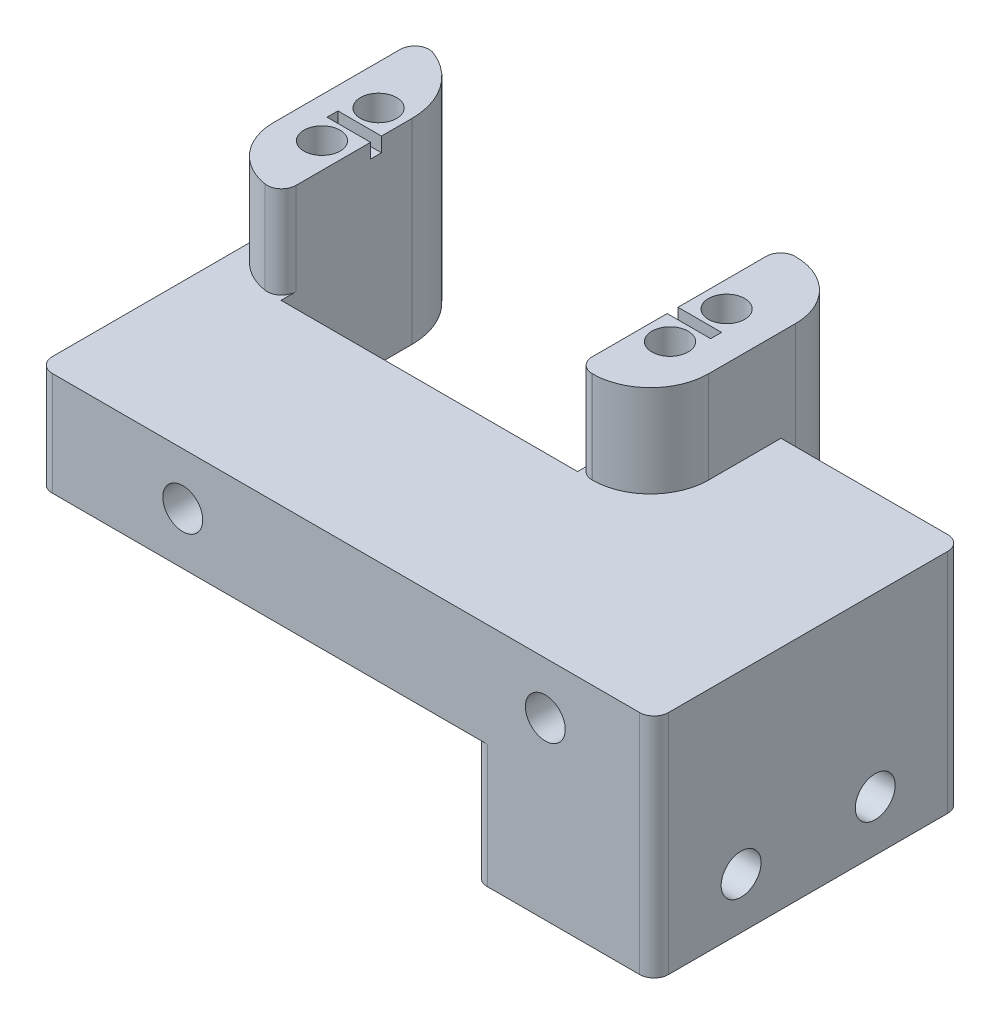
from build123d import *

# Parameters (mm, degrees)
SKETCH1_W           = 85
SKETCH1_H           = 52.5
BOSS_EXTRUDE1_DEPTH = 27
SKETCH2_R           = 2.5
CUT_EXTRUDE1_DEPTH  = 104.490337713
SKETCH4_W           = 24.5
SKETCH4_H           = 12.7
CUT_EXTRUDE2_DEPTH  = 104.490337713
SKETCH5_W           = 25
SKETCH5_H           = 12.7
CUT_EXTRUDE3_DEPTH  = 94.477269964
SKETCH6_W           = 40.9
SKETCH6_H           = 28
CUT_EXTRUDE4_DEPTH  = 104.490337713
FILLET1_R           = 10
FILLET2_R           = 8
FILLET4_R           = 2
SKETCH7_R           = 2.75
CUT_EXTRUDE5_DEPTH  = 104.490337713
SKETCH8_W           = 6
SKETCH8_H           = 1.5
CUT_EXTRUDE6_DEPTH  = 2
CUT_EXTRUDE7_DEPTH  = 101.924427172
BOSS_EXTRUDE2_START = 17
BOSS_EXTRUDE2_DEPTH = 17
SKETCH11_R          = 2.75
CUT_EXTRUDE8_DEPTH  = 104.490337713
FILLET5_R           = 2


with BuildPart() as part:
    # Sketch1 → Boss-Extrude1 (new body)
    with BuildSketch(Plane(origin=(0, 0, 0), x_dir=(1, 0, 0), z_dir=(0, 1, 0))):
        with Locations((42.5, 26.25)):
            Rectangle(SKETCH1_W, SKETCH1_H)
    extrude(amount=BOSS_EXTRUDE1_DEPTH)

    # Sketch2 → Cut-Extrude1 (cut, through all)
    with BuildSketch(Plane(origin=(0, 27, 0), x_dir=(1, 0, 0), z_dir=(0, 1, 0))):
        with Locations(Location((5.5, 41.5, 0), (0, 0, 270))):
            Circle(SKETCH2_R)
        with Locations(Location((53.5, 41.5, 0), (0, 0, 270))):
            Circle(SKETCH2_R)
        with Locations(Location((53.5, 33.7, 0), (0, 0, 270))):
            Circle(SKETCH2_R)
        with Locations(Location((5.5, 33.7, 0), (0, 0, 270))):
            Circle(SKETCH2_R)
    extrude(amount=-CUT_EXTRUDE1_DEPTH, mode=Mode.SUBTRACT)

    # Sketch4 → Cut-Extrude2 (cut, through all)
    with BuildSketch(Plane.ZY):
        with Locations((-12.25, 20.65)):
            Rectangle(SKETCH4_W, SKETCH4_H)
    extrude(amount=-CUT_EXTRUDE2_DEPTH, mode=Mode.SUBTRACT)

    # Sketch5 → Cut-Extrude3 (cut, through all)
    with BuildSketch(Plane.XY.offset(-24.5)):
        with Locations((72.5, 20.65)):
            Rectangle(SKETCH5_W, SKETCH5_H)
    extrude(amount=-CUT_EXTRUDE3_DEPTH, mode=Mode.SUBTRACT)

    # Sketch6 → Cut-Extrude4 (cut, through all)
    with BuildSketch(Plane(origin=(0, 27, 0), x_dir=(1, 0, 0), z_dir=(0, 1, 0))):
        with Locations((29.5, 38.5)):
            Rectangle(SKETCH6_W, SKETCH6_H)
    extrude(amount=-CUT_EXTRUDE4_DEPTH, mode=Mode.SUBTRACT)

    # Fillet1
    # the kernel refuses this fillet: 10 mm, written as the material it takes off along each edge
    with BuildSketch(Plane(origin=(9.05, 51.886931812, -52.5), x_dir=(-1, 0, 0), z_dir=(0, -1, 0))) as fillet1_piece_1:
        with BuildLine():
            CenterArc((10, -9.954772725), FILLET1_R, 95.451319812, 84.548680188)
            Line((0, -9.954772725), (-0.2, -9.954772725))
            Line((-0.2, -9.954772725), (-0.2, 0))
            Line((-0.2, 0), (0, 0.2))
            ThreePointArc((0, 0.2), (4.525, 0.2), (9.031, 0.199095454))
            Line((9.031, 0.199095454), (9.05, 0))
        make_face()
    extrude(amount=76.773863623, mode=Mode.SUBTRACT)

    # Fillet2
    fillet2_edges = [part.edges().sort_by_distance(p)[0] for p in [
        (0, 20.65, -24.5),
        (60, 20.65, -52.5),
        (60, 20.65, -24.5),
    ]]
    fillet(fillet2_edges, radius=FILLET2_R)

    # Fillet4
    # the kernel refuses this fillet: 2 mm, written as the material it takes off along each edge
    with BuildSketch(Plane(origin=(9.05, 32.797158858, -24.5), x_dir=(0, 0, -1), z_dir=(0, -1, 0))) as fillet4_piece_1:
        with BuildLine():
            CenterArc((2.075685694, -2), FILLET4_R, 90, 99.110170153)
            Line((0.100914258, -2.316666667), (-0.096562885, -2.348333333))
            ThreePointArc((-0.096562885, -2.348333333), (-0.2, -1.05), (-0.2, 0))
            Line((-0.2, 0), (0, 0.2))
            Line((0, 0.2), (2.075685694, 0.2))
            Line((2.075685694, 0.2), (2.075685694, 0))
        make_face()
    extrude(amount=18.497158858, mode=Mode.SUBTRACT)
    with BuildSketch(Plane(origin=(49.95, 32, -24.5), x_dir=(0, 0, -1), z_dir=(0, -1, 0))) as fillet4_piece_2:
        with BuildLine():
            CenterArc((FILLET4_R, FILLET4_R), FILLET4_R, 180, 90)
            Line((0, FILLET4_R), (0, 0))
            Line((0, 0), (FILLET4_R, 0))
        make_face()
    extrude(amount=17.7, mode=Mode.SUBTRACT)
    with BuildSketch(Plane(origin=(49.95, 32, -52.5), x_dir=(0, 0, 1), z_dir=(0, -1, 0))) as fillet4_piece_3:
        with BuildLine():
            CenterArc((FILLET4_R, -FILLET4_R), FILLET4_R, 90, 90)
            Line((0, -FILLET4_R), (0, 0))
            Line((0, 0), (FILLET4_R, 0))
        make_face()
    extrude(amount=37, mode=Mode.SUBTRACT)
    with BuildSketch(Plane(origin=(85, -5, -52.5), x_dir=(0, 0, 1), z_dir=(0, 1, 0)), Plane(origin=(85, -5, 0), x_dir=(-1, 0, 0), z_dir=(0, 1, 0)), Plane(origin=(0, -5, 0), x_dir=(0, 0, -1), z_dir=(0, 1, 0))) as fillet4_piece_4:
        with BuildLine():
            CenterArc((FILLET4_R, -FILLET4_R), FILLET4_R, 90, 90)
            Line((0, -FILLET4_R), (0, 0))
            Line((0, 0), (FILLET4_R, 0))
        make_face()
    extrude(amount=24.3, mode=Mode.SUBTRACT)
    with BuildSketch(Plane(origin=(0, -7.039544043, -52.5), x_dir=(0.972186544788057, 0, 0.23420786095487744), z_dir=(0, 1, 0))) as fillet4_piece_5:
        with BuildLine():
            CenterArc((2.534235855, -1.980078713), FILLET4_R, 81.906386313, 111.638547186)
            Line((0.589862766, -2.448494435), (0, 0))
            ThreePointArc((0, 0), (1.407908809, 0.099606433), (2.815817617, 0))
        make_face()
    extrude(amount=41.079088086, mode=Mode.SUBTRACT)

    # Sketch7 → Cut-Extrude5 (cut, through all)
    with BuildSketch(Plane.XY):
        with Locations((70, 7.15)):
            Circle(SKETCH7_R)
        with Locations((20, 7.15)):
            Circle(SKETCH7_R)
    extrude(amount=-CUT_EXTRUDE5_DEPTH, mode=Mode.SUBTRACT)

    # Sketch8 → Cut-Extrude6 (cut)
    with BuildSketch(Plane(origin=(0, 27, 0), x_dir=(1, 0, 0), z_dir=(0, 1, 0))):
        with Locations((6.05, 37.6)):
            Rectangle(SKETCH8_W, SKETCH8_H)
        with Locations((52.95, 37.6)):
            Rectangle(SKETCH8_W, SKETCH8_H)
    extrude(amount=-CUT_EXTRUDE6_DEPTH, mode=Mode.SUBTRACT)

    # Sketch9 → Cut-Extrude7 (cut, through all)
    with BuildSketch(Plane(origin=(0, 14.3, 0), x_dir=(1, 0, 0), z_dir=(0, 1, 0))):
        with BuildLine():
            Line((85, 42.5), (60, 42.5))
            Line((60, 42.5), (60, 44.5))
            ThreePointArc((60, 44.5), (57.656854249, 50.156854249), (52, 52.5))
            Line((52, 52.5), (83, 52.5))
            Line((83, 52.5), (85, 52.5))
            Line((85, 52.5), (85, 42.5))
        make_face()
    extrude(amount=-CUT_EXTRUDE7_DEPTH, mode=Mode.SUBTRACT)

    # Sketch10 → Boss-Extrude2 (add)
    with BuildSketch(Plane.XZ.offset(BOSS_EXTRUDE2_START)):
        with BuildLine():
            Line((85, -42.5), (60, -42.5))
            Line((60, -42.5), (60, 0))
            Line((60, 0), (83, 0))
            ThreePointArc((83, 0), (84.414213562, -0.585786438), (85, -2))
            Line((85, -2), (85, -42.5))
        make_face()
    extrude(amount=-BOSS_EXTRUDE2_DEPTH)

    # Sketch11 → Cut-Extrude8 (cut, through all)
    with BuildSketch(Plane(origin=(85, 0, 0), x_dir=(0, 0, -1), z_dir=(1, 0, 0))):
        with Locations((30.5, -10)):
            Circle(SKETCH11_R)
        with Locations((12, -10)):
            Circle(SKETCH11_R)
    extrude(amount=-CUT_EXTRUDE8_DEPTH, mode=Mode.SUBTRACT)

    # Fillet5
    fillet5_edges = [part.edges().sort_by_distance(p)[0] for p in [
        (85, -1.35, -42.5),
        (60, -8.5, 0),
        (60, -8.5, -42.5),
    ]]
    fillet(fillet5_edges, radius=FILLET5_R)


solid = part.part
